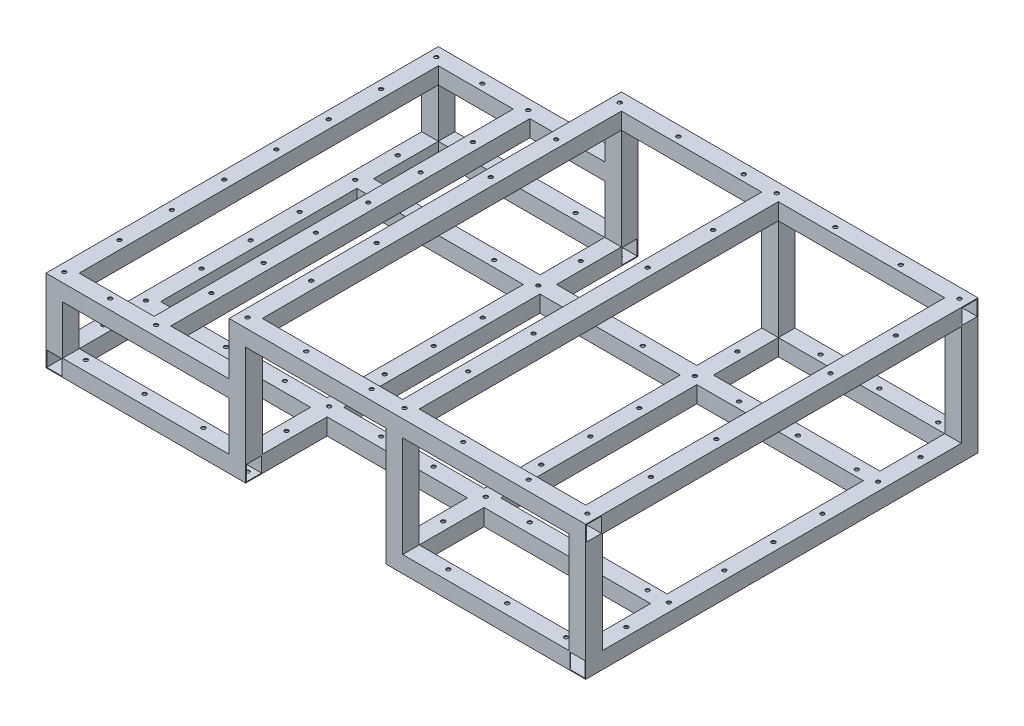
from build123d import *

# Parameters (mm, degrees)
SKETCH1_W                      = 774.6
SKETCH1_H                      = 25.4
BOSS_EXTRUDE1_DEPTH            = 25.4
BOSS_EXTRUDE1_2_DEPTH          = 25.4
SKETCH4_W                      = 23
SKETCH4_H                      = 23
CUT_EXTRUDE2_DEPTH             = 774.6
SKETCH2_W                      = 25.4
SKETCH2_H                      = 600
BOSS_EXTRUDE2_DEPTH            = 25.4
CUT_EXTRUDE1_REACH             = 730.674
SKETCH3_W                      = 23
SKETCH3_H                      = 23
SKETCH6_W                      = 25.4
SKETCH6_H                      = 25.4
BOSS_EXTRUDE3_DEPTH            = 280
SKETCH7_W                      = 25.4
SKETCH7_H                      = 25.4
BOSS_EXTRUDE4_DEPTH            = 280
CUT_EXTRUDE4_REACH             = 512.849
SKETCH8_W                      = 23
SKETCH8_H                      = 23
CUT_EXTRUDE4_DIRECTION_2_DEPTH = 388.5
BOSS_EXTRUDE5_REACH            = 709.906
SKETCH9_W                      = 25.4
SKETCH9_H                      = 25.4
SKETCH9_W_2                    = 23
SKETCH9_H_2                    = 23
SKETCH11_W                     = 25.4
SKETCH11_H                     = 25.4
SKETCH11_W_2                   = 23
SKETCH11_H_2                   = 23
BOSS_EXTRUDE6_DEPTH            = 74.6
SKETCH12_W                     = 25.4
SKETCH12_H                     = 25.4
SKETCH12_W_2                   = 23
SKETCH12_H_2                   = 23
BOSS_EXTRUDE7_DEPTH            = 154.6
SKETCH13_W                     = 545.4
SKETCH13_H                     = 25.4
BOSS_EXTRUDE9_DEPTH            = 25.4
SKETCH14_W                     = 23
SKETCH14_H                     = 23
CUT_EXTRUDE5_DEPTH             = 545.4
SKETCH15_W                     = 25.4
SKETCH15_H                     = 25.4
SKETCH15_W_2                   = 23
SKETCH15_H_2                   = 23
BOSS_EXTRUDE10_DEPTH           = 549.2
SKETCH16_W                     = 25.4
SKETCH16_H                     = 25.4
SKETCH16_W_2                   = 23
SKETCH16_H_2                   = 23
BOSS_EXTRUDE11_DEPTH           = 280
SKETCH17_W                     = 25.4
SKETCH17_H                     = 25.4
SKETCH17_W_2                   = 23
SKETCH17_H_2                   = 23
BOSS_EXTRUDE12_DEPTH           = 549.2
SKETCH18_R                     = 3
CUT_EXTRUDE6_DEPTH             = 25.4
SKETCH20_R                     = 3
CUT_EXTRUDE7_DEPTH             = 1.2
CUT_EXTRUDE8_REACH             = 527.401
SKETCH21_R                     = 3


with BuildPart() as part:
    # Sketch1 → Boss-Extrude1 (new body)
    with BuildSketch(Plane(origin=(0, 0, 0), x_dir=(1, 0, 0), z_dir=(0, 1, 0))):
        with Locations((0, -162.7)):
            Rectangle(SKETCH1_W, SKETCH1_H)
    extrude(amount=BOSS_EXTRUDE1_DEPTH)


with BuildPart() as body_2:
    # Sketch1 → Boss-Extrude1 2 (new body)
    with BuildSketch(Plane(origin=(0, 0, 0), x_dir=(1, 0, 0), z_dir=(0, 1, 0))):
        with Locations((0, 162.7)):
            Rectangle(SKETCH1_W, SKETCH1_H)
    extrude(amount=BOSS_EXTRUDE1_2_DEPTH)


with BuildPart() as cut_extrude2_tool:
    # Sketch4 → Cut-Extrude2 (new body)
    with BuildSketch(Plane.ZY.offset(387.3)):
        with Locations((-162.7, 12.7)):
            Rectangle(SKETCH4_W, SKETCH4_H)
        with Locations((162.7, 12.7)):
            Rectangle(SKETCH4_W, SKETCH4_H)
    extrude(amount=-CUT_EXTRUDE2_DEPTH)


with BuildPart() as part_1:
    add(part.part)

    # Cut-Extrude2: cut by cut_extrude2_tool
    add(cut_extrude2_tool.part, mode=Mode.SUBTRACT)



with BuildPart() as body_2_1:
    add(body_2.part)

    # Cut-Extrude2: cut by cut_extrude2_tool
    add(cut_extrude2_tool.part, mode=Mode.SUBTRACT)


with BuildPart() as part_2:
    add(part_1.part)

    add(body_2_1.part)  # Boss-Extrude2 merges body 2
    # Sketch2 → Boss-Extrude2 (add)
    with BuildSketch(Plane.XZ):
        with Locations((400, 0)):
            Rectangle(SKETCH2_W, SKETCH2_H)
        with Locations((-400, 0)):
            Rectangle(SKETCH2_W, SKETCH2_H)
    extrude(amount=-BOSS_EXTRUDE2_DEPTH)

    # Sketch3 → Cut-Extrude1 (cut, up to next)
    with BuildSketch(Plane(origin=(0, 0, -300), x_dir=(-1, 0, 0), z_dir=(0, 0, -1)), mode=Mode.PRIVATE) as cut_extrude1_sk1:
        with Locations((-400, 12.7)):
            Rectangle(SKETCH3_W, SKETCH3_H)
    cut_extrude1_tool1 = extrude(cut_extrude1_sk1.sketch, amount=-CUT_EXTRUDE1_REACH, mode=Mode.PRIVATE) & part_2.part
    # Sketch3 → Cut-Extrude1 (cut, up to next)
    with BuildSketch(Plane(origin=(0, 0, -300), x_dir=(-1, 0, 0), z_dir=(0, 0, -1)), mode=Mode.PRIVATE) as cut_extrude1_sk2:
        with Locations((400, 12.7)):
            Rectangle(SKETCH3_W, SKETCH3_H)
    cut_extrude1_tool2 = extrude(cut_extrude1_sk2.sketch, amount=-CUT_EXTRUDE1_REACH, mode=Mode.PRIVATE) & part_2.part
    add(cut_extrude1_tool1.solids().sort_by_distance((400, 12.7, -300))[0], mode=Mode.SUBTRACT)
    add(cut_extrude1_tool2.solids().sort_by_distance((-400, 12.7, -300))[0], mode=Mode.SUBTRACT)

    # Sketch6 → Boss-Extrude3 (add)
    with BuildSketch(Plane(origin=(-387.3, 0, 0), x_dir=(0, 0, -1), z_dir=(1, 0, 0))):
        with Locations((287.3, 12.7)):
            Rectangle(SKETCH6_W, SKETCH6_H)
        with Locations((-287.3, 12.7)):
            Rectangle(SKETCH6_W, SKETCH6_H)
    extrude(amount=BOSS_EXTRUDE3_DEPTH)

    # Sketch7 → Boss-Extrude4 (add)
    with BuildSketch(Plane.ZY.offset(-387.3)):
        with Locations((-287.3, 12.7)):
            Rectangle(SKETCH7_W, SKETCH7_H)
        with Locations((287.3, 12.7)):
            Rectangle(SKETCH7_W, SKETCH7_H)
    extrude(amount=BOSS_EXTRUDE4_DEPTH)

    # Cut-Extrude4: up to this face of the body (flat: up to its plane)
    cut_extrude4_end = Plane(part_2.part.faces().sort_by_distance((-388.5, 12.7, 0))[0])
    # Sketch8 → Cut-Extrude4 (cut, up to the picked face)
    with BuildSketch(Plane(origin=(0, 0, 0), x_dir=(0, 0, -1), z_dir=(1, 0, 0)), mode=Mode.PRIVATE) as cut_extrude4_sk1:
        with Locations((-287.3, 12.7)):
            Rectangle(SKETCH8_W, SKETCH8_H)
    cut_extrude4_tool1 = split(extrude(cut_extrude4_sk1.sketch, amount=-CUT_EXTRUDE4_REACH, mode=Mode.PRIVATE), bisect_by=cut_extrude4_end, keep=Keep.BOTH, mode=Mode.PRIVATE)
    # Sketch8 → Cut-Extrude4 (cut, up to the picked face)
    with BuildSketch(Plane(origin=(0, 0, 0), x_dir=(0, 0, -1), z_dir=(1, 0, 0)), mode=Mode.PRIVATE) as cut_extrude4_sk2:
        with Locations((287.3, 12.7)):
            Rectangle(SKETCH8_W, SKETCH8_H)
    cut_extrude4_tool2 = split(extrude(cut_extrude4_sk2.sketch, amount=-CUT_EXTRUDE4_REACH, mode=Mode.PRIVATE), bisect_by=cut_extrude4_end, keep=Keep.BOTH, mode=Mode.PRIVATE)
    add(cut_extrude4_tool1.solids().sort_by(Axis((0, 12.7, 287.3), (-1, 0, 0)))[0], mode=Mode.SUBTRACT)
    add(cut_extrude4_tool2.solids().sort_by(Axis((0, 12.7, -287.3), (-1, 0, 0)))[0], mode=Mode.SUBTRACT)

    # Sketch8 → Cut-Extrude4 direction 2 (cut)
    with BuildSketch(Plane(origin=(0, 0, 0), x_dir=(0, 0, -1), z_dir=(1, 0, 0))):
        with Locations((-287.3, 12.7)):
            Rectangle(SKETCH8_W, SKETCH8_H)
        with Locations((287.3, 12.7)):
            Rectangle(SKETCH8_W, SKETCH8_H)
    extrude(amount=CUT_EXTRUDE4_DIRECTION_2_DEPTH, mode=Mode.SUBTRACT)

    # Boss-Extrude5: up to this face of the body (flat: up to its plane)
    boss_extrude5_end = Plane(part_2.part.faces().sort_by_distance((-247.9, 12.7, 275.8))[0])
    # Sketch9 → Boss-Extrude5 (add, up to the picked face)
    with BuildSketch(Plane.XY.offset(-274.6), mode=Mode.PRIVATE) as boss_extrude5_sk1:
        with Locations((-120, 12.7)):
            Rectangle(SKETCH9_W, SKETCH9_H)
        with Locations((-120, 12.7)):
            Rectangle(SKETCH9_W_2, SKETCH9_H_2, mode=Mode.SUBTRACT)
    boss_extrude5_tool1 = split(extrude(boss_extrude5_sk1.sketch, amount=BOSS_EXTRUDE5_REACH, mode=Mode.PRIVATE), bisect_by=boss_extrude5_end, keep=Keep.BOTH, mode=Mode.PRIVATE)
    # Sketch9 → Boss-Extrude5 (add, up to the picked face)
    with BuildSketch(Plane.XY.offset(-274.6), mode=Mode.PRIVATE) as boss_extrude5_sk2:
        with Locations((120, 12.7)):
            Rectangle(SKETCH9_W, SKETCH9_H)
        with Locations((120, 12.7)):
            Rectangle(SKETCH9_W_2, SKETCH9_H_2, mode=Mode.SUBTRACT)
    boss_extrude5_tool2 = split(extrude(boss_extrude5_sk2.sketch, amount=BOSS_EXTRUDE5_REACH, mode=Mode.PRIVATE), bisect_by=boss_extrude5_end, keep=Keep.BOTH, mode=Mode.PRIVATE)
    add(boss_extrude5_tool1.solids().sort_by(Axis((-120, 0.35921, -274.6), (0, 0, 1)))[0])
    add(boss_extrude5_tool2.solids().sort_by(Axis((120, 25.04079, -274.6), (0, 0, 1)))[0])

    # Sketch11 → Boss-Extrude6 (add)
    # profile 1 of 2: a face of its own
    with BuildSketch(Plane(origin=(0, 25.4, 0), x_dir=(1, 0, 0), z_dir=(0, 1, 0))):
        with Locations((-400, 287.3)):
            Rectangle(SKETCH11_W, SKETCH11_H)
        with Locations((-400, 287.3)):
            Rectangle(SKETCH11_W_2, SKETCH11_H_2, mode=Mode.SUBTRACT)
    # profile 2 of 2: a face of its own
    with BuildSketch(Plane(origin=(0, 25.4, 0), x_dir=(1, 0, 0), z_dir=(0, 1, 0))):
        with Locations((-400, -287.3)):
            Rectangle(SKETCH11_W, SKETCH11_H)
        with Locations((-400, -287.3)):
            Rectangle(SKETCH11_W_2, SKETCH11_H_2, mode=Mode.SUBTRACT)
    extrude(amount=BOSS_EXTRUDE6_DEPTH)

    # Sketch12 → Boss-Extrude7 (add)
    # profile 1 of 6: a face of its own
    with BuildSketch(Plane(origin=(0, 25.4, 0), x_dir=(1, 0, 0), z_dir=(0, 1, 0))):
        with Locations((-120, 287.3)):
            Rectangle(SKETCH12_W, SKETCH12_H)
        with Locations((-120, 287.3)):
            Rectangle(SKETCH12_W_2, SKETCH12_H_2, mode=Mode.SUBTRACT)
    # profile 2 of 6: a face of its own
    with BuildSketch(Plane(origin=(0, 25.4, 0), x_dir=(1, 0, 0), z_dir=(0, 1, 0))):
        with Locations((-120, -287.3)):
            Rectangle(SKETCH12_W, SKETCH12_H)
        with Locations((-120, -287.3)):
            Rectangle(SKETCH12_W_2, SKETCH12_H_2, mode=Mode.SUBTRACT)
    # profile 3 of 6: a face of its own
    with BuildSketch(Plane(origin=(0, 25.4, 0), x_dir=(1, 0, 0), z_dir=(0, 1, 0))):
        with Locations((400, -287.3)):
            Rectangle(SKETCH12_W, SKETCH12_H)
        with Locations((400, -287.3)):
            Rectangle(SKETCH12_W_2, SKETCH12_H_2, mode=Mode.SUBTRACT)
    # profile 4 of 6: a face of its own
    with BuildSketch(Plane(origin=(0, 25.4, 0), x_dir=(1, 0, 0), z_dir=(0, 1, 0))):
        with Locations((400, 287.3)):
            Rectangle(SKETCH12_W, SKETCH12_H)
        with Locations((400, 287.3)):
            Rectangle(SKETCH12_W_2, SKETCH12_H_2, mode=Mode.SUBTRACT)
    # profile 5 of 6: a face of its own
    with BuildSketch(Plane(origin=(0, 25.4, 0), x_dir=(1, 0, 0), z_dir=(0, 1, 0))):
        with Locations((120, 287.3)):
            Rectangle(SKETCH12_W, SKETCH12_H)
        with Locations((120, 287.3)):
            Rectangle(SKETCH12_W_2, SKETCH12_H_2, mode=Mode.SUBTRACT)
    # profile 6 of 6: a face of its own
    with BuildSketch(Plane(origin=(0, 25.4, 0), x_dir=(1, 0, 0), z_dir=(0, 1, 0))):
        with Locations((120, -287.3)):
            Rectangle(SKETCH12_W, SKETCH12_H)
        with Locations((120, -287.3)):
            Rectangle(SKETCH12_W_2, SKETCH12_H_2, mode=Mode.SUBTRACT)
    extrude(amount=BOSS_EXTRUDE7_DEPTH)

    # Sketch13 → Boss-Extrude9 (add)
    with BuildSketch(Plane(origin=(0, 180, 0), x_dir=(1, 0, 0), z_dir=(0, 1, 0))):
        with Locations((140, -287.3)):
            Rectangle(SKETCH13_W, SKETCH13_H)
        with Locations((140, 287.3)):
            Rectangle(SKETCH13_W, SKETCH13_H)
    extrude(amount=BOSS_EXTRUDE9_DEPTH)

    # Sketch14 → Cut-Extrude5 (cut)
    with BuildSketch(Plane.ZY.offset(132.7)):
        with Locations((-287.3, 192.7)):
            Rectangle(SKETCH14_W, SKETCH14_H)
        with Locations((287.3, 192.7)):
            Rectangle(SKETCH14_W, SKETCH14_H)
    extrude(amount=-CUT_EXTRUDE5_DEPTH, mode=Mode.SUBTRACT)

    # Sketch15 → Boss-Extrude10 (add)
    # profile 1 of 3: a face of its own
    with BuildSketch(Plane.XY.offset(-274.6)):
        with Locations((120, 192.7)):
            Rectangle(SKETCH15_W, SKETCH15_H)
        with Locations((120, 192.7)):
            Rectangle(SKETCH15_W_2, SKETCH15_H_2, mode=Mode.SUBTRACT)
    # profile 2 of 3: a face of its own
    with BuildSketch(Plane.XY.offset(-274.6)):
        with Locations((-120, 192.7)):
            Rectangle(SKETCH15_W, SKETCH15_H)
        with Locations((-120, 192.7)):
            Rectangle(SKETCH15_W_2, SKETCH15_H_2, mode=Mode.SUBTRACT)
    # profile 3 of 3: a face of its own
    with BuildSketch(Plane.XY.offset(-274.6)):
        with Locations((400, 192.7)):
            Rectangle(SKETCH15_W, SKETCH15_H)
        with Locations((400, 192.7)):
            Rectangle(SKETCH15_W_2, SKETCH15_H_2, mode=Mode.SUBTRACT)
    extrude(amount=BOSS_EXTRUDE10_DEPTH)

    # Sketch16 → Boss-Extrude11 (add)
    # profile 1 of 2: a face of its own
    with BuildSketch(Plane.ZY.offset(412.7)):
        with Locations((287.3, 112.7)):
            Rectangle(SKETCH16_W, SKETCH16_H)
        with Locations((287.3, 112.7)):
            Rectangle(SKETCH16_W_2, SKETCH16_H_2, mode=Mode.SUBTRACT)
    # profile 2 of 2: a face of its own
    with BuildSketch(Plane.ZY.offset(412.7)):
        with Locations((-287.3, 112.7)):
            Rectangle(SKETCH16_W, SKETCH16_H)
        with Locations((-287.3, 112.7)):
            Rectangle(SKETCH16_W_2, SKETCH16_H_2, mode=Mode.SUBTRACT)
    extrude(amount=-BOSS_EXTRUDE11_DEPTH)

    # Sketch17 → Boss-Extrude12 (add)
    # profile 1 of 2: a face of its own
    with BuildSketch(Plane(origin=(0, 0, 274.6), x_dir=(-1, 0, 0), z_dir=(0, 0, -1))):
        with Locations((400, 112.7)):
            Rectangle(SKETCH17_W, SKETCH17_H)
        with Locations((400, 112.7)):
            Rectangle(SKETCH17_W_2, SKETCH17_H_2, mode=Mode.SUBTRACT)
    # profile 2 of 2: a face of its own
    with BuildSketch(Plane(origin=(0, 0, 274.6), x_dir=(-1, 0, 0), z_dir=(0, 0, -1))):
        with Locations((260, 112.7)):
            Rectangle(SKETCH17_W, SKETCH17_H)
        with Locations((260, 112.7)):
            Rectangle(SKETCH17_W_2, SKETCH17_H_2, mode=Mode.SUBTRACT)
    extrude(amount=BOSS_EXTRUDE12_DEPTH)

    # Sketch18 → Cut-Extrude6 (cut)
    with BuildSketch(Plane(origin=(0, 25.4, 0), x_dir=(1, 0, 0), z_dir=(0, 1, 0))):
        with Locations(Location((367.3, 284.6, 0), (0, 0, 270))):
            Circle(SKETCH18_R)
        with Locations(Location((277.3, 284.6, 0), (0, 0, 270))):
            Circle(SKETCH18_R)
        with Locations(Location((187.3, 284.6, 0), (0, 0, 270))):
            Circle(SKETCH18_R)
        with Locations(Location((119.8, 284.6, 0), (0, 0, 270))):
            Circle(SKETCH18_R)
        with Locations(Location((367.3, 160, 0), (0, 0, 270))):
            Circle(SKETCH18_R)
        with Locations(Location((277.3, 160, 0), (0, 0, 270))):
            Circle(SKETCH18_R)
        with Locations(Location((187.3, 160, 0), (0, 0, 270))):
            Circle(SKETCH18_R)
        with Locations(Location((119.8, 160, 0), (0, 0, 270))):
            Circle(SKETCH18_R)
        with Locations(Location((119.8, 225, 0), (0, 0, 270))):
            Circle(SKETCH18_R)
        with Locations(Location((399.8, 225, 0), (0, 0, 270))):
            Circle(SKETCH18_R)
        with Locations(Location((399.8, 0, 0), (0, 0, 270))):
            Circle(SKETCH18_R)
        with Locations(Location((399.8, 75, 0), (0, 0, 270))):
            Circle(SKETCH18_R)
        with Locations(Location((119.8, 0, 0), (0, 0, 270))):
            Circle(SKETCH18_R)
        with Locations(Location((119.8, 75, 0), (0, 0, 270))):
            Circle(SKETCH18_R)
        with Locations(Location((399.8, 160, 0), (0, 0, 270))):
            Circle(SKETCH18_R)
        with Locations(Location((40, 160, 0), (0, 0, 270))):
            Circle(SKETCH18_R)
        with Locations(Location((-40, 160, 0), (0, 0, 270))):
            Circle(SKETCH18_R)
        with Locations(Location((-399.8, 160, 0), (0, 0, 270))):
            Circle(SKETCH18_R)
        with Locations((-119.8, 75)):
            Circle(SKETCH18_R)
        with Locations((-119.8, 0)):
            Circle(SKETCH18_R)
        with Locations(Location((-399.8, 75, 0), (0, 0, 270))):
            Circle(SKETCH18_R)
        with Locations(Location((-399.8, 0, 0), (0, 0, 270))):
            Circle(SKETCH18_R)
        with Locations(Location((-399.8, 225, 0), (0, 0, 270))):
            Circle(SKETCH18_R)
        with Locations((-119.8, 225)):
            Circle(SKETCH18_R)
        with Locations(Location((-119.8, 160, 0), (0, 0, 270))):
            Circle(SKETCH18_R)
        with Locations(Location((-187.3, 160, 0), (0, 0, 270))):
            Circle(SKETCH18_R)
        with Locations(Location((-277.3, 160, 0), (0, 0, 270))):
            Circle(SKETCH18_R)
        with Locations(Location((-367.3, 160, 0), (0, 0, 270))):
            Circle(SKETCH18_R)
        with Locations(Location((-119.8, 284.6, 0), (0, 0, 270))):
            Circle(SKETCH18_R)
        with Locations(Location((-187.3, 284.6, 0), (0, 0, 270))):
            Circle(SKETCH18_R)
        with Locations(Location((-277.3, 284.6, 0), (0, 0, 270))):
            Circle(SKETCH18_R)
        with Locations(Location((-367.3, 284.6, 0), (0, 0, 270))):
            Circle(SKETCH18_R)
        with Locations(Location((-367.3, -284.6, 0), (0, 0, 270))):
            Circle(SKETCH18_R)
        with Locations(Location((-277.3, -284.6, 0), (0, 0, 270))):
            Circle(SKETCH18_R)
        with Locations(Location((-187.3, -284.6, 0), (0, 0, 270))):
            Circle(SKETCH18_R)
        with Locations(Location((-119.8, -284.6, 0), (0, 0, 270))):
            Circle(SKETCH18_R)
        with Locations(Location((-367.3, -160, 0), (0, 0, 270))):
            Circle(SKETCH18_R)
        with Locations(Location((-277.3, -160, 0), (0, 0, 270))):
            Circle(SKETCH18_R)
        with Locations(Location((-187.3, -160, 0), (0, 0, 270))):
            Circle(SKETCH18_R)
        with Locations(Location((-119.8, -160, 0), (0, 0, 270))):
            Circle(SKETCH18_R)
        with Locations(Location((-119.8, -225, 0), (0, 0, 270))):
            Circle(SKETCH18_R)
        with Locations(Location((-399.8, -225, 0), (0, 0, 270))):
            Circle(SKETCH18_R)
        with Locations(Location((-399.8, -75, 0), (0, 0, 270))):
            Circle(SKETCH18_R)
        with Locations(Location((-119.8, -75, 0), (0, 0, 270))):
            Circle(SKETCH18_R)
        with Locations(Location((-399.8, -160, 0), (0, 0, 270))):
            Circle(SKETCH18_R)
        with Locations(Location((-40, -160, 0), (0, 0, 270))):
            Circle(SKETCH18_R)
        with Locations(Location((40, -160, 0), (0, 0, 270))):
            Circle(SKETCH18_R)
        with Locations(Location((399.8, -160, 0), (0, 0, 270))):
            Circle(SKETCH18_R)
        with Locations((119.8, -75)):
            Circle(SKETCH18_R)
        with Locations(Location((399.8, -75, 0), (0, 0, 270))):
            Circle(SKETCH18_R)
        with Locations(Location((399.8, -225, 0), (0, 0, 270))):
            Circle(SKETCH18_R)
        with Locations((119.8, -225)):
            Circle(SKETCH18_R)
        with Locations(Location((119.8, -160, 0), (0, 0, 270))):
            Circle(SKETCH18_R)
        with Locations(Location((187.3, -160, 0), (0, 0, 270))):
            Circle(SKETCH18_R)
        with Locations(Location((277.3, -160, 0), (0, 0, 270))):
            Circle(SKETCH18_R)
        with Locations(Location((367.3, -160, 0), (0, 0, 270))):
            Circle(SKETCH18_R)
        with Locations(Location((119.8, -284.6, 0), (0, 0, 270))):
            Circle(SKETCH18_R)
        with Locations(Location((187.3, -284.6, 0), (0, 0, 270))):
            Circle(SKETCH18_R)
        with Locations(Location((277.3, -284.6, 0), (0, 0, 270))):
            Circle(SKETCH18_R)
        with Locations(Location((367.3, -284.6, 0), (0, 0, 270))):
            Circle(SKETCH18_R)
    extrude(amount=-CUT_EXTRUDE6_DEPTH, mode=Mode.SUBTRACT)

    # Sketch20 → Cut-Extrude7 (cut)
    with BuildSketch(Plane(origin=(0, 205.4, 0), x_dir=(1, 0, 0), z_dir=(0, 1, 0))):
        with Locations(Location((399.8, 284.6, 0), (0, 0, 270))):
            Circle(SKETCH20_R)
        with Locations(Location((399.8, 187.3, 0), (0, 0, 270))):
            Circle(SKETCH20_R)
        with Locations(Location((310, 284.6, 0), (0, 0, 270))):
            Circle(SKETCH20_R)
        with Locations(Location((210, 284.6, 0), (0, 0, 270))):
            Circle(SKETCH20_R)
        with Locations(Location((120.2, 187.3, 0), (0, 0, 90))):
            Circle(SKETCH20_R)
        with Locations(Location((120.2, 284.6, 0), (0, 0, 270))):
            Circle(SKETCH20_R)
        with Locations(Location((120.2, 87.3, 0), (0, 0, 270))):
            Circle(SKETCH20_R)
        with Locations(Location((399.8, 87.3, 0), (0, 0, 90))):
            Circle(SKETCH20_R)
        with Locations(Location((399.8, -87.3, 0), (0, 0, 270))):
            Circle(SKETCH20_R)
        with Locations(Location((120.2, -87.3, 0), (0, 0, 90))):
            Circle(SKETCH20_R)
        with Locations(Location((120.2, -284.6, 0), (0, 0, 270))):
            Circle(SKETCH20_R)
        with Locations(Location((120.2, -187.3, 0), (0, 0, 270))):
            Circle(SKETCH20_R)
        with Locations(Location((210, -284.6, 0), (0, 0, 270))):
            Circle(SKETCH20_R)
        with Locations(Location((310, -284.6, 0), (0, 0, 270))):
            Circle(SKETCH20_R)
        with Locations(Location((399.8, -187.3, 0), (0, 0, 90))):
            Circle(SKETCH20_R)
        with Locations(Location((399.8, -284.6, 0), (0, 0, 270))):
            Circle(SKETCH20_R)
        with Locations(Location((-119.8, -284.6, 0), (0, 0, 270))):
            Circle(SKETCH20_R)
        with Locations(Location((-119.8, -187.3, 0), (0, 0, 270))):
            Circle(SKETCH20_R)
        with Locations(Location((-30, -284.6, 0), (0, 0, 270))):
            Circle(SKETCH20_R)
        with Locations(Location((70, -284.6, 0), (0, 0, 270))):
            Circle(SKETCH20_R)
        with Locations(Location((-119.8, -87.3, 0), (0, 0, 90))):
            Circle(SKETCH20_R)
        with Locations(Location((-119.8, 87.3, 0), (0, 0, 270))):
            Circle(SKETCH20_R)
        with Locations(Location((70, 284.6, 0), (0, 0, 270))):
            Circle(SKETCH20_R)
        with Locations(Location((-30, 284.6, 0), (0, 0, 270))):
            Circle(SKETCH20_R)
        with Locations(Location((-119.8, 187.3, 0), (0, 0, 90))):
            Circle(SKETCH20_R)
        with Locations(Location((-119.8, 284.6, 0), (0, 0, 270))):
            Circle(SKETCH20_R)
    extrude(amount=-CUT_EXTRUDE7_DEPTH, mode=Mode.SUBTRACT)

    # Sketch21 → Cut-Extrude8 (cut, up to next)
    with BuildSketch(Plane(origin=(0, 125.4, 0), x_dir=(1, 0, 0), z_dir=(0, 1, 0)), mode=Mode.PRIVATE) as cut_extrude8_sk1:
        with Locations(Location((-400.2, 284.6, 0), (0, 0, 270))):
            Circle(SKETCH21_R)
    cut_extrude8_tool1 = extrude(cut_extrude8_sk1.sketch, amount=-CUT_EXTRUDE8_REACH, mode=Mode.PRIVATE) & part_2.part
    # Sketch21 → Cut-Extrude8 (cut, up to next)
    with BuildSketch(Plane(origin=(0, 125.4, 0), x_dir=(1, 0, 0), z_dir=(0, 1, 0)), mode=Mode.PRIVATE) as cut_extrude8_sk2:
        with Locations(Location((-329.995, 284.6, 0), (0, 0, 270))):
            Circle(SKETCH21_R)
    cut_extrude8_tool2 = extrude(cut_extrude8_sk2.sketch, amount=-CUT_EXTRUDE8_REACH, mode=Mode.PRIVATE) & part_2.part
    # Sketch21 → Cut-Extrude8 (cut, up to next)
    with BuildSketch(Plane(origin=(0, 125.4, 0), x_dir=(1, 0, 0), z_dir=(0, 1, 0)), mode=Mode.PRIVATE) as cut_extrude8_sk3:
        with Locations(Location((-400.2, 200, 0), (0, 0, 270))):
            Circle(SKETCH21_R)
    cut_extrude8_tool3 = extrude(cut_extrude8_sk3.sketch, amount=-CUT_EXTRUDE8_REACH, mode=Mode.PRIVATE) & part_2.part
    # Sketch21 → Cut-Extrude8 (cut, up to next)
    with BuildSketch(Plane(origin=(0, 125.4, 0), x_dir=(1, 0, 0), z_dir=(0, 1, 0)), mode=Mode.PRIVATE) as cut_extrude8_sk4:
        with Locations(Location((-400.2, 120, 0), (0, 0, 270))):
            Circle(SKETCH21_R)
    cut_extrude8_tool4 = extrude(cut_extrude8_sk4.sketch, amount=-CUT_EXTRUDE8_REACH, mode=Mode.PRIVATE) & part_2.part
    # Sketch21 → Cut-Extrude8 (cut, up to next)
    with BuildSketch(Plane(origin=(0, 125.4, 0), x_dir=(1, 0, 0), z_dir=(0, 1, 0)), mode=Mode.PRIVATE) as cut_extrude8_sk5:
        with Locations(Location((-400.2, 40, 0), (0, 0, 270))):
            Circle(SKETCH21_R)
    cut_extrude8_tool5 = extrude(cut_extrude8_sk5.sketch, amount=-CUT_EXTRUDE8_REACH, mode=Mode.PRIVATE) & part_2.part
    # Sketch21 → Cut-Extrude8 (cut, up to next)
    with BuildSketch(Plane(origin=(0, 125.4, 0), x_dir=(1, 0, 0), z_dir=(0, 1, 0)), mode=Mode.PRIVATE) as cut_extrude8_sk6:
        with Locations(Location((-259.8, 40, 0), (0, 0, 90))):
            Circle(SKETCH21_R)
    cut_extrude8_tool6 = extrude(cut_extrude8_sk6.sketch, amount=-CUT_EXTRUDE8_REACH, mode=Mode.PRIVATE) & part_2.part
    # Sketch21 → Cut-Extrude8 (cut, up to next)
    with BuildSketch(Plane(origin=(0, 125.4, 0), x_dir=(1, 0, 0), z_dir=(0, 1, 0)), mode=Mode.PRIVATE) as cut_extrude8_sk7:
        with Locations(Location((-259.8, 120, 0), (0, 0, 90))):
            Circle(SKETCH21_R)
    cut_extrude8_tool7 = extrude(cut_extrude8_sk7.sketch, amount=-CUT_EXTRUDE8_REACH, mode=Mode.PRIVATE) & part_2.part
    # Sketch21 → Cut-Extrude8 (cut, up to next)
    with BuildSketch(Plane(origin=(0, 125.4, 0), x_dir=(1, 0, 0), z_dir=(0, 1, 0)), mode=Mode.PRIVATE) as cut_extrude8_sk8:
        with Locations(Location((-259.8, 200, 0), (0, 0, 90))):
            Circle(SKETCH21_R)
    cut_extrude8_tool8 = extrude(cut_extrude8_sk8.sketch, amount=-CUT_EXTRUDE8_REACH, mode=Mode.PRIVATE) & part_2.part
    # Sketch21 → Cut-Extrude8 (cut, up to next)
    with BuildSketch(Plane(origin=(0, 125.4, 0), x_dir=(1, 0, 0), z_dir=(0, 1, 0)), mode=Mode.PRIVATE) as cut_extrude8_sk9:
        with Locations(Location((-259.8, 284.6, 0), (0, 0, 270))):
            Circle(SKETCH21_R)
    cut_extrude8_tool9 = extrude(cut_extrude8_sk9.sketch, amount=-CUT_EXTRUDE8_REACH, mode=Mode.PRIVATE) & part_2.part
    # Sketch21 → Cut-Extrude8 (cut, up to next)
    with BuildSketch(Plane(origin=(0, 125.4, 0), x_dir=(1, 0, 0), z_dir=(0, 1, 0)), mode=Mode.PRIVATE) as cut_extrude8_sk10:
        with Locations(Location((-259.8, -284.6, 0), (0, 0, 270))):
            Circle(SKETCH21_R)
    cut_extrude8_tool10 = extrude(cut_extrude8_sk10.sketch, amount=-CUT_EXTRUDE8_REACH, mode=Mode.PRIVATE) & part_2.part
    # Sketch21 → Cut-Extrude8 (cut, up to next)
    with BuildSketch(Plane(origin=(0, 125.4, 0), x_dir=(1, 0, 0), z_dir=(0, 1, 0)), mode=Mode.PRIVATE) as cut_extrude8_sk11:
        with Locations(Location((-259.8, -200, 0), (0, 0, 270))):
            Circle(SKETCH21_R)
    cut_extrude8_tool11 = extrude(cut_extrude8_sk11.sketch, amount=-CUT_EXTRUDE8_REACH, mode=Mode.PRIVATE) & part_2.part
    # Sketch21 → Cut-Extrude8 (cut, up to next)
    with BuildSketch(Plane(origin=(0, 125.4, 0), x_dir=(1, 0, 0), z_dir=(0, 1, 0)), mode=Mode.PRIVATE) as cut_extrude8_sk12:
        with Locations(Location((-259.8, -120, 0), (0, 0, 270))):
            Circle(SKETCH21_R)
    cut_extrude8_tool12 = extrude(cut_extrude8_sk12.sketch, amount=-CUT_EXTRUDE8_REACH, mode=Mode.PRIVATE) & part_2.part
    # Sketch21 → Cut-Extrude8 (cut, up to next)
    with BuildSketch(Plane(origin=(0, 125.4, 0), x_dir=(1, 0, 0), z_dir=(0, 1, 0)), mode=Mode.PRIVATE) as cut_extrude8_sk13:
        with Locations(Location((-400.2, -40, 0), (0, 0, 90))):
            Circle(SKETCH21_R)
    cut_extrude8_tool13 = extrude(cut_extrude8_sk13.sketch, amount=-CUT_EXTRUDE8_REACH, mode=Mode.PRIVATE) & part_2.part
    # Sketch21 → Cut-Extrude8 (cut, up to next)
    with BuildSketch(Plane(origin=(0, 125.4, 0), x_dir=(1, 0, 0), z_dir=(0, 1, 0)), mode=Mode.PRIVATE) as cut_extrude8_sk14:
        with Locations(Location((-400.2, -120, 0), (0, 0, 90))):
            Circle(SKETCH21_R)
    cut_extrude8_tool14 = extrude(cut_extrude8_sk14.sketch, amount=-CUT_EXTRUDE8_REACH, mode=Mode.PRIVATE) & part_2.part
    # Sketch21 → Cut-Extrude8 (cut, up to next)
    with BuildSketch(Plane(origin=(0, 125.4, 0), x_dir=(1, 0, 0), z_dir=(0, 1, 0)), mode=Mode.PRIVATE) as cut_extrude8_sk15:
        with Locations(Location((-400.2, -200, 0), (0, 0, 90))):
            Circle(SKETCH21_R)
    cut_extrude8_tool15 = extrude(cut_extrude8_sk15.sketch, amount=-CUT_EXTRUDE8_REACH, mode=Mode.PRIVATE) & part_2.part
    # Sketch21 → Cut-Extrude8 (cut, up to next)
    with BuildSketch(Plane(origin=(0, 125.4, 0), x_dir=(1, 0, 0), z_dir=(0, 1, 0)), mode=Mode.PRIVATE) as cut_extrude8_sk16:
        with Locations(Location((-329.995, -284.6, 0), (0, 0, 270))):
            Circle(SKETCH21_R)
    cut_extrude8_tool16 = extrude(cut_extrude8_sk16.sketch, amount=-CUT_EXTRUDE8_REACH, mode=Mode.PRIVATE) & part_2.part
    # Sketch21 → Cut-Extrude8 (cut, up to next)
    with BuildSketch(Plane(origin=(0, 125.4, 0), x_dir=(1, 0, 0), z_dir=(0, 1, 0)), mode=Mode.PRIVATE) as cut_extrude8_sk17:
        with Locations(Location((-400.2, -284.6, 0), (0, 0, 270))):
            Circle(SKETCH21_R)
    cut_extrude8_tool17 = extrude(cut_extrude8_sk17.sketch, amount=-CUT_EXTRUDE8_REACH, mode=Mode.PRIVATE) & part_2.part
    # Sketch21 → Cut-Extrude8 (cut, up to next)
    with BuildSketch(Plane(origin=(0, 125.4, 0), x_dir=(1, 0, 0), z_dir=(0, 1, 0)), mode=Mode.PRIVATE) as cut_extrude8_sk18:
        with Locations(Location((-259.8, -40, 0), (0, 0, 270))):
            Circle(SKETCH21_R)
    cut_extrude8_tool18 = extrude(cut_extrude8_sk18.sketch, amount=-CUT_EXTRUDE8_REACH, mode=Mode.PRIVATE) & part_2.part
    add(cut_extrude8_tool1.solids().sort_by_distance((-400.2, 125.4, -284.6))[0], mode=Mode.SUBTRACT)
    add(cut_extrude8_tool2.solids().sort_by_distance((-329.995, 125.4, -284.6))[0], mode=Mode.SUBTRACT)
    add(cut_extrude8_tool3.solids().sort_by_distance((-400.2, 125.4, -200))[0], mode=Mode.SUBTRACT)
    add(cut_extrude8_tool4.solids().sort_by_distance((-400.2, 125.4, -120))[0], mode=Mode.SUBTRACT)
    add(cut_extrude8_tool5.solids().sort_by_distance((-400.2, 125.4, -40))[0], mode=Mode.SUBTRACT)
    add(cut_extrude8_tool6.solids().sort_by_distance((-259.8, 125.4, -40))[0], mode=Mode.SUBTRACT)
    add(cut_extrude8_tool7.solids().sort_by_distance((-259.8, 125.4, -120))[0], mode=Mode.SUBTRACT)
    add(cut_extrude8_tool8.solids().sort_by_distance((-259.8, 125.4, -200))[0], mode=Mode.SUBTRACT)
    add(cut_extrude8_tool9.solids().sort_by_distance((-259.8, 125.4, -284.6))[0], mode=Mode.SUBTRACT)
    add(cut_extrude8_tool10.solids().sort_by_distance((-259.8, 125.4, 284.6))[0], mode=Mode.SUBTRACT)
    add(cut_extrude8_tool11.solids().sort_by_distance((-259.8, 125.4, 200))[0], mode=Mode.SUBTRACT)
    add(cut_extrude8_tool12.solids().sort_by_distance((-259.8, 125.4, 120))[0], mode=Mode.SUBTRACT)
    add(cut_extrude8_tool13.solids().sort_by_distance((-400.2, 125.4, 40))[0], mode=Mode.SUBTRACT)
    add(cut_extrude8_tool14.solids().sort_by_distance((-400.2, 125.4, 120))[0], mode=Mode.SUBTRACT)
    add(cut_extrude8_tool15.solids().sort_by_distance((-400.2, 125.4, 200))[0], mode=Mode.SUBTRACT)
    add(cut_extrude8_tool16.solids().sort_by_distance((-329.995, 125.4, 284.6))[0], mode=Mode.SUBTRACT)
    add(cut_extrude8_tool17.solids().sort_by_distance((-400.2, 125.4, 284.6))[0], mode=Mode.SUBTRACT)
    add(cut_extrude8_tool18.solids().sort_by_distance((-259.8, 125.4, 40))[0], mode=Mode.SUBTRACT)


solid = part_2.part
